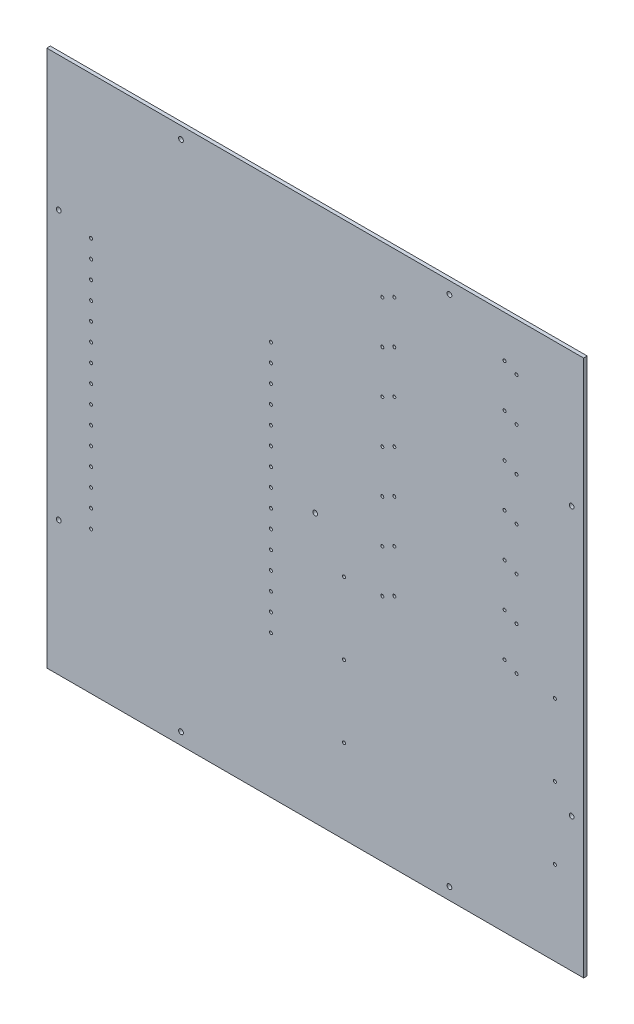
from build123d import *

# Parameters (mm, degrees)
SCHIZZO1_W                   = 448
SCHIZZO1_H                   = 448
SCHIZZO1_R                   = 2
SCHIZZO1_R_2                 = 1.25
ESTRUSIONE_ESTRUSIONE1_DEPTH = 3


with BuildPart() as part:
    # Schizzo1 → Estrusione-Estrusione1 (new body)
    with BuildSketch(Plane.XY):
        with Locations((224, 224)):
            Rectangle(SCHIZZO1_W, SCHIZZO1_H)
        with Locations((10, 336)):
            Circle(SCHIZZO1_R, mode=Mode.SUBTRACT)
        with Locations((336, 438)):
            Circle(SCHIZZO1_R, mode=Mode.SUBTRACT)
        with Locations((438, 336)):
            Circle(SCHIZZO1_R, mode=Mode.SUBTRACT)
        with Locations((438, 112)):
            Circle(SCHIZZO1_R, mode=Mode.SUBTRACT)
        with Locations((336, 10)):
            Circle(SCHIZZO1_R, mode=Mode.SUBTRACT)
        with Locations((112, 10)):
            Circle(SCHIZZO1_R, mode=Mode.SUBTRACT)
        with Locations((10, 112)):
            Circle(SCHIZZO1_R, mode=Mode.SUBTRACT)
        with Locations((36.958788995, 224)):
            Circle(SCHIZZO1_R_2, mode=Mode.SUBTRACT)
        with Locations((112, 438)):
            Circle(SCHIZZO1_R, mode=Mode.SUBTRACT)
        with Locations((36.958788995, 239)):
            Circle(SCHIZZO1_R_2, mode=Mode.SUBTRACT)
        with Locations((36.958788995, 254)):
            Circle(SCHIZZO1_R_2, mode=Mode.SUBTRACT)
        with Locations((36.958788995, 269)):
            Circle(SCHIZZO1_R_2, mode=Mode.SUBTRACT)
        with Locations((36.958788995, 284)):
            Circle(SCHIZZO1_R_2, mode=Mode.SUBTRACT)
        with Locations((36.958788995, 299)):
            Circle(SCHIZZO1_R_2, mode=Mode.SUBTRACT)
        with Locations((36.958788995, 314)):
            Circle(SCHIZZO1_R_2, mode=Mode.SUBTRACT)
        with Locations((36.958788995, 329)):
            Circle(SCHIZZO1_R_2, mode=Mode.SUBTRACT)
        with Locations((248, 70)):
            Circle(SCHIZZO1_R_2, mode=Mode.SUBTRACT)
        with Locations((248, 130)):
            Circle(SCHIZZO1_R_2, mode=Mode.SUBTRACT)
        with Locations((424, 130)):
            Circle(SCHIZZO1_R_2, mode=Mode.SUBTRACT)
        with Locations((424, 70)):
            Circle(SCHIZZO1_R_2, mode=Mode.SUBTRACT)
        with Locations((290, 413)):
            Circle(SCHIZZO1_R_2, mode=Mode.SUBTRACT)
        with Locations((280, 408)):
            Circle(SCHIZZO1_R_2, mode=Mode.SUBTRACT)
        with Locations((392, 408)):
            Circle(SCHIZZO1_R_2, mode=Mode.SUBTRACT)
        with Locations((382, 413)):
            Circle(SCHIZZO1_R_2, mode=Mode.SUBTRACT)
        with Locations((290, 377)):
            Circle(SCHIZZO1_R_2, mode=Mode.SUBTRACT)
        with Locations((280, 372)):
            Circle(SCHIZZO1_R_2, mode=Mode.SUBTRACT)
        with Locations((392, 372)):
            Circle(SCHIZZO1_R_2, mode=Mode.SUBTRACT)
        with Locations((382, 377)):
            Circle(SCHIZZO1_R_2, mode=Mode.SUBTRACT)
        with Locations((290, 341)):
            Circle(SCHIZZO1_R_2, mode=Mode.SUBTRACT)
        with Locations((280, 336)):
            Circle(SCHIZZO1_R_2, mode=Mode.SUBTRACT)
        with Locations((392, 336)):
            Circle(SCHIZZO1_R_2, mode=Mode.SUBTRACT)
        with Locations((382, 341)):
            Circle(SCHIZZO1_R_2, mode=Mode.SUBTRACT)
        with Locations((290, 305)):
            Circle(SCHIZZO1_R_2, mode=Mode.SUBTRACT)
        with Locations((280, 300)):
            Circle(SCHIZZO1_R_2, mode=Mode.SUBTRACT)
        with Locations((392, 300)):
            Circle(SCHIZZO1_R_2, mode=Mode.SUBTRACT)
        with Locations((382, 305)):
            Circle(SCHIZZO1_R_2, mode=Mode.SUBTRACT)
        with Locations((290, 269)):
            Circle(SCHIZZO1_R_2, mode=Mode.SUBTRACT)
        with Locations((280, 264)):
            Circle(SCHIZZO1_R_2, mode=Mode.SUBTRACT)
        with Locations((392, 264)):
            Circle(SCHIZZO1_R_2, mode=Mode.SUBTRACT)
        with Locations((382, 269)):
            Circle(SCHIZZO1_R_2, mode=Mode.SUBTRACT)
        with Locations((290, 233)):
            Circle(SCHIZZO1_R_2, mode=Mode.SUBTRACT)
        with Locations((280, 228)):
            Circle(SCHIZZO1_R_2, mode=Mode.SUBTRACT)
        with Locations((392, 228)):
            Circle(SCHIZZO1_R_2, mode=Mode.SUBTRACT)
        with Locations((382, 233)):
            Circle(SCHIZZO1_R_2, mode=Mode.SUBTRACT)
        with Locations((290, 197)):
            Circle(SCHIZZO1_R_2, mode=Mode.SUBTRACT)
        with Locations((280, 192)):
            Circle(SCHIZZO1_R_2, mode=Mode.SUBTRACT)
        with Locations((392, 192)):
            Circle(SCHIZZO1_R_2, mode=Mode.SUBTRACT)
        with Locations((382, 197)):
            Circle(SCHIZZO1_R_2, mode=Mode.SUBTRACT)
        with Locations((36.958788995, 119)):
            Circle(SCHIZZO1_R_2, mode=Mode.SUBTRACT)
        with Locations((36.958788995, 134)):
            Circle(SCHIZZO1_R_2, mode=Mode.SUBTRACT)
        with Locations((36.958788995, 149)):
            Circle(SCHIZZO1_R_2, mode=Mode.SUBTRACT)
        with Locations((36.958788995, 164)):
            Circle(SCHIZZO1_R_2, mode=Mode.SUBTRACT)
        with Locations((36.958788995, 179)):
            Circle(SCHIZZO1_R_2, mode=Mode.SUBTRACT)
        with Locations((36.958788995, 194)):
            Circle(SCHIZZO1_R_2, mode=Mode.SUBTRACT)
        with Locations((36.958788995, 209)):
            Circle(SCHIZZO1_R_2, mode=Mode.SUBTRACT)
        with Locations((187.041211005, 209)):
            Circle(SCHIZZO1_R_2, mode=Mode.SUBTRACT)
        with Locations((187.041211005, 194)):
            Circle(SCHIZZO1_R_2, mode=Mode.SUBTRACT)
        with Locations((187.041211005, 179)):
            Circle(SCHIZZO1_R_2, mode=Mode.SUBTRACT)
        with Locations((187.041211005, 164)):
            Circle(SCHIZZO1_R_2, mode=Mode.SUBTRACT)
        with Locations((187.041211005, 149)):
            Circle(SCHIZZO1_R_2, mode=Mode.SUBTRACT)
        with Locations((187.041211005, 134)):
            Circle(SCHIZZO1_R_2, mode=Mode.SUBTRACT)
        with Locations((187.041211005, 119)):
            Circle(SCHIZZO1_R_2, mode=Mode.SUBTRACT)
        with Locations((187.041211005, 329)):
            Circle(SCHIZZO1_R_2, mode=Mode.SUBTRACT)
        with Locations((187.041211005, 314)):
            Circle(SCHIZZO1_R_2, mode=Mode.SUBTRACT)
        with Locations((187.041211005, 299)):
            Circle(SCHIZZO1_R_2, mode=Mode.SUBTRACT)
        with Locations((187.041211005, 284)):
            Circle(SCHIZZO1_R_2, mode=Mode.SUBTRACT)
        with Locations((187.041211005, 269)):
            Circle(SCHIZZO1_R_2, mode=Mode.SUBTRACT)
        with Locations((187.041211005, 254)):
            Circle(SCHIZZO1_R_2, mode=Mode.SUBTRACT)
        with Locations((187.041211005, 239)):
            Circle(SCHIZZO1_R_2, mode=Mode.SUBTRACT)
        with Locations((187.041211005, 224)):
            Circle(SCHIZZO1_R_2, mode=Mode.SUBTRACT)
        with Locations((224, 224)):
            Circle(SCHIZZO1_R, mode=Mode.SUBTRACT)
        with Locations((424, 190)):
            Circle(SCHIZZO1_R_2, mode=Mode.SUBTRACT)
        with Locations((248, 190)):
            Circle(SCHIZZO1_R_2, mode=Mode.SUBTRACT)
    extrude(amount=-ESTRUSIONE_ESTRUSIONE1_DEPTH)


solid = part.part
